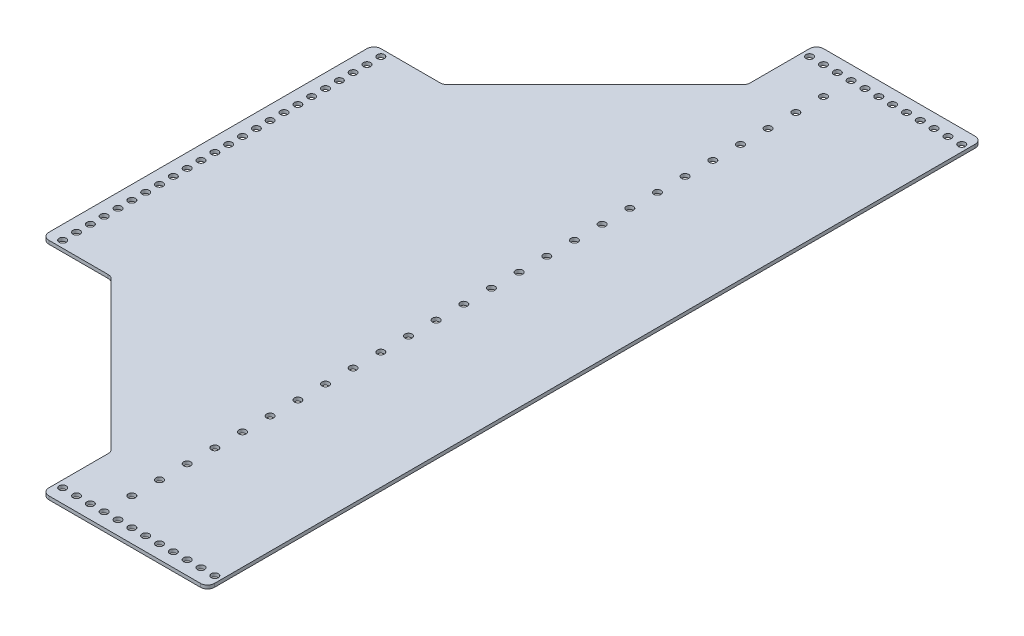
from build123d import *

# Parameters (mm, degrees)
BOSS_EXTRUDE2_DEPTH = 1.5875
SKETCH2_R           = 3.2639
CUT_EXTRUDE1_DEPTH  = 795.974704399
FILLET1_R           = 6.35
LPATTERN1_START     = -1.5875
LPATTERN1_OUTLINE_R = 3.2639
LPATTERN1_DEPTH     = 3.175
LPATTERN2_START     = -1.5875
LPATTERN2_OUTLINE_R = 3.2639
LPATTERN2_DEPTH     = 3.175
SKETCH3_R           = 3.2639
CUT_EXTRUDE2_DEPTH  = 795.974704399


# Read off the part's stored shape, not the designer's step: LPattern1, LPattern2
with BuildPart() as part:
    # Sketch1 → Boss-Extrude2 (new, symmetric)
    with BuildSketch(Plane(origin=(0, 0, 0), x_dir=(1, 0, 0), z_dir=(0, 1, 0))):
        Polygon((0, 203.2), (63.5, 203.2), (133.096984938, 133.603015062), (203.2, 63.5), (203.2, 0), (355.203125, 0), (355.203125, 711.2), (203.2, 711.2), (203.2, 647.7), (63.5, 508), (0, 508), align=None)
    extrude(amount=BOSS_EXTRUDE2_DEPTH, both=True)

    # Sketch2 → Cut-Extrude1 (cut, through all)
    with BuildSketch(Plane(origin=(0, 1.5875, 0), x_dir=(1, 0, 0), z_dir=(0, 1, 0))):
        with Locations(Location((209.55, 698.5, 0), (0, 0, 270))):
            Circle(SKETCH2_R)
        with Locations(Location((12.7, 501.65, 0), (0, 0, 270))):
            Circle(SKETCH2_R)
        with Locations(Location((209.55, 12.7, 0), (0, 0, 270))):
            Circle(SKETCH2_R)
    extrude(amount=-CUT_EXTRUDE1_DEPTH, mode=Mode.SUBTRACT)

    # Fillet1
    fillet1_edges = [part.edges().sort_by_distance(p)[0] for p in [
        (0, 0, -508),
        (63.5, 0, -508),
        (203.2, 0, -647.7),
        (203.2, 0, -711.2),
        (355.203125, 0, -711.2),
        (355.203125, 0, 0),
        (203.2, 0, 0),
        (203.2, 0, -63.5),
        (63.5, 0, -203.2),
        (0, 0, -203.2),
    ]]
    fillet(fillet1_edges, radius=FILLET1_R)

    # LPattern1 outline → LPattern1 (cut)
    with BuildSketch(Plane(origin=(0, 0, 0), x_dir=(1, 0, 0), z_dir=(0, 1, 0)).offset(LPATTERN1_START)):
        with Locations((12.7, 209.55)):
            Circle(LPATTERN1_OUTLINE_R)
        with Locations((12.7, 222.25)):
            Circle(LPATTERN1_OUTLINE_R)
        with Locations((12.7, 234.95)):
            Circle(LPATTERN1_OUTLINE_R)
        with Locations((12.7, 247.65)):
            Circle(LPATTERN1_OUTLINE_R)
        with Locations((12.7, 260.35)):
            Circle(LPATTERN1_OUTLINE_R)
        with Locations((12.7, 273.05)):
            Circle(LPATTERN1_OUTLINE_R)
        with Locations((12.7, 285.75)):
            Circle(LPATTERN1_OUTLINE_R)
        with Locations((12.7, 298.45)):
            Circle(LPATTERN1_OUTLINE_R)
        with Locations((12.7, 311.15)):
            Circle(LPATTERN1_OUTLINE_R)
        with Locations((12.7, 323.85)):
            Circle(LPATTERN1_OUTLINE_R)
        with Locations((12.7, 336.55)):
            Circle(LPATTERN1_OUTLINE_R)
        with Locations((12.7, 349.25)):
            Circle(LPATTERN1_OUTLINE_R)
        with Locations((12.7, 361.95)):
            Circle(LPATTERN1_OUTLINE_R)
        with Locations((12.7, 374.65)):
            Circle(LPATTERN1_OUTLINE_R)
        with Locations((12.7, 387.35)):
            Circle(LPATTERN1_OUTLINE_R)
        with Locations((12.7, 400.05)):
            Circle(LPATTERN1_OUTLINE_R)
        with Locations((12.7, 412.75)):
            Circle(LPATTERN1_OUTLINE_R)
        with Locations((12.7, 425.45)):
            Circle(LPATTERN1_OUTLINE_R)
        with Locations((12.7, 438.15)):
            Circle(LPATTERN1_OUTLINE_R)
        with Locations((12.7, 450.85)):
            Circle(LPATTERN1_OUTLINE_R)
        with Locations((12.7, 463.55)):
            Circle(LPATTERN1_OUTLINE_R)
        with Locations((12.7, 476.25)):
            Circle(LPATTERN1_OUTLINE_R)
        with Locations((12.7, 488.95)):
            Circle(LPATTERN1_OUTLINE_R)
    extrude(amount=LPATTERN1_DEPTH, mode=Mode.SUBTRACT)

    # LPattern2 outline → LPattern2 (cut)
    with BuildSketch(Plane(origin=(0, 0, 0), x_dir=(1, 0, 0), z_dir=(0, 1, 0)).offset(LPATTERN2_START)):
        with Locations((349.25, 12.7)):
            Circle(LPATTERN2_OUTLINE_R)
        with Locations((349.25, 698.5)):
            Circle(LPATTERN2_OUTLINE_R)
        with Locations((336.55, 12.7)):
            Circle(LPATTERN2_OUTLINE_R)
        with Locations((336.55, 698.5)):
            Circle(LPATTERN2_OUTLINE_R)
        with Locations((323.85, 12.7)):
            Circle(LPATTERN2_OUTLINE_R)
        with Locations((323.85, 698.5)):
            Circle(LPATTERN2_OUTLINE_R)
        with Locations((311.15, 12.7)):
            Circle(LPATTERN2_OUTLINE_R)
        with Locations((311.15, 698.5)):
            Circle(LPATTERN2_OUTLINE_R)
        with Locations((298.45, 12.7)):
            Circle(LPATTERN2_OUTLINE_R)
        with Locations((298.45, 698.5)):
            Circle(LPATTERN2_OUTLINE_R)
        with Locations((285.75, 12.7)):
            Circle(LPATTERN2_OUTLINE_R)
        with Locations((285.75, 698.5)):
            Circle(LPATTERN2_OUTLINE_R)
        with Locations((273.05, 12.7)):
            Circle(LPATTERN2_OUTLINE_R)
        with Locations((273.05, 698.5)):
            Circle(LPATTERN2_OUTLINE_R)
        with Locations((260.35, 12.7)):
            Circle(LPATTERN2_OUTLINE_R)
        with Locations((260.35, 698.5)):
            Circle(LPATTERN2_OUTLINE_R)
        with Locations((247.65, 12.7)):
            Circle(LPATTERN2_OUTLINE_R)
        with Locations((247.65, 698.5)):
            Circle(LPATTERN2_OUTLINE_R)
        with Locations((234.95, 12.7)):
            Circle(LPATTERN2_OUTLINE_R)
        with Locations((234.95, 698.5)):
            Circle(LPATTERN2_OUTLINE_R)
        with Locations((222.25, 12.7)):
            Circle(LPATTERN2_OUTLINE_R)
        with Locations((222.25, 698.5)):
            Circle(LPATTERN2_OUTLINE_R)
    extrude(amount=LPATTERN2_DEPTH, mode=Mode.SUBTRACT)

    # Sketch3 → Cut-Extrude2 (cut, through all)
    with BuildSketch(Plane(origin=(0, 1.5875, 0), x_dir=(1, 0, 0), z_dir=(0, 1, 0))):
        with Locations(Location((247.65, 698.5, 0), (0, 0, 270))):
            Circle(SKETCH3_R)
        with Locations(Location((247.65, 673.1, 0), (0, 0, 270))):
            Circle(SKETCH3_R)
        with Locations(Location((247.65, 647.7, 0), (0, 0, 270))):
            Circle(SKETCH3_R)
        with Locations(Location((247.65, 622.3, 0), (0, 0, 270))):
            Circle(SKETCH3_R)
        with Locations(Location((247.65, 596.9, 0), (0, 0, 270))):
            Circle(SKETCH3_R)
        with Locations(Location((247.65, 571.5, 0), (0, 0, 270))):
            Circle(SKETCH3_R)
        with Locations(Location((247.65, 546.1, 0), (0, 0, 270))):
            Circle(SKETCH3_R)
        with Locations(Location((247.65, 520.7, 0), (0, 0, 270))):
            Circle(SKETCH3_R)
        with Locations(Location((247.65, 495.3, 0), (0, 0, 270))):
            Circle(SKETCH3_R)
        with Locations(Location((247.65, 469.9, 0), (0, 0, 270))):
            Circle(SKETCH3_R)
        with Locations(Location((247.65, 444.5, 0), (0, 0, 270))):
            Circle(SKETCH3_R)
        with Locations(Location((247.65, 419.1, 0), (0, 0, 270))):
            Circle(SKETCH3_R)
        with Locations(Location((247.65, 393.7, 0), (0, 0, 270))):
            Circle(SKETCH3_R)
        with Locations(Location((247.65, 368.3, 0), (0, 0, 270))):
            Circle(SKETCH3_R)
        with Locations(Location((247.65, 342.9, 0), (0, 0, 270))):
            Circle(SKETCH3_R)
        with Locations(Location((247.65, 317.5, 0), (0, 0, 270))):
            Circle(SKETCH3_R)
        with Locations(Location((247.65, 292.1, 0), (0, 0, 270))):
            Circle(SKETCH3_R)
        with Locations(Location((247.65, 266.7, 0), (0, 0, 270))):
            Circle(SKETCH3_R)
        with Locations(Location((247.65, 241.3, 0), (0, 0, 270))):
            Circle(SKETCH3_R)
        with Locations(Location((247.65, 215.9, 0), (0, 0, 270))):
            Circle(SKETCH3_R)
        with Locations(Location((247.65, 190.5, 0), (0, 0, 270))):
            Circle(SKETCH3_R)
        with Locations(Location((247.65, 165.1, 0), (0, 0, 270))):
            Circle(SKETCH3_R)
        with Locations(Location((247.65, 139.7, 0), (0, 0, 270))):
            Circle(SKETCH3_R)
        with Locations(Location((247.65, 114.3, 0), (0, 0, 270))):
            Circle(SKETCH3_R)
        with Locations(Location((247.65, 88.9, 0), (0, 0, 270))):
            Circle(SKETCH3_R)
        with Locations(Location((247.65, 63.5, 0), (0, 0, 270))):
            Circle(SKETCH3_R)
        with Locations(Location((247.65, 38.1, 0), (0, 0, 270))):
            Circle(SKETCH3_R)
    extrude(amount=-CUT_EXTRUDE2_DEPTH, mode=Mode.SUBTRACT)


solid = part.part
